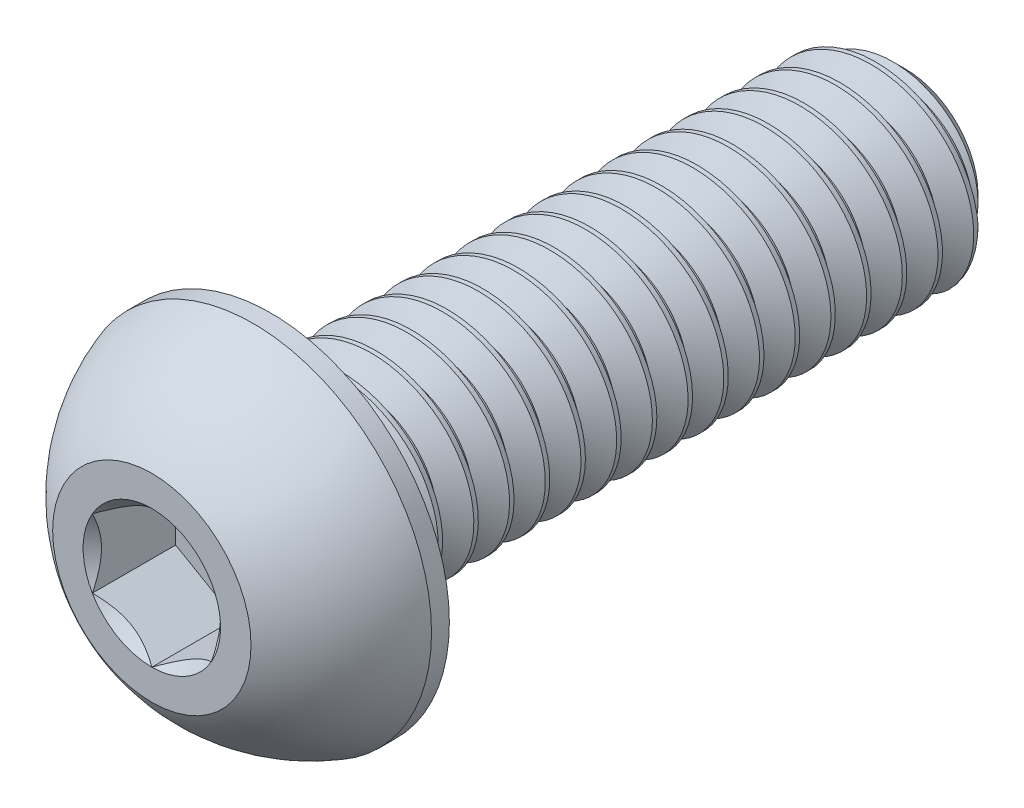
from build123d import *

# Parameters (mm, degrees)
CUT_EXTRUDE2_DEPTH = 1.05
CUT_SWEEP2_PITCH   = 0.45
CUT_SWEEP2_TO      = 8


with BuildPart() as part:
    # Sketch10 → Revolve3 (revolve)
    with BuildSketch(Plane(origin=(0, 0, 0), x_dir=(0, 0, -1), z_dir=(1, 0, 0)), mode=Mode.PRIVATE) as revolve3_sk:
        Polygon((9.1625, 1.25), (9.5, 0.9125), (9.5, 0), (1.5, 0), (1.5, 1.25), align=None)
    revolve(revolve3_sk.sketch.rotate(Axis((0, 0, 0), (0, 0, -1)), 90), axis=Axis((0, 0, 0), (0, 0, -1)))

    # Sketch7 → Revolve2 (revolve)
    with BuildSketch(Plane(origin=(0, 0, 0), x_dir=(0, 0, -1), z_dir=(1, 0, 0)), mode=Mode.PRIVATE) as revolve2_sk:
        with BuildLine():
            Line((1.275, 2.25), (1.5, 2.25))
            Line((1.5, 2.25), (1.5, 0))
            Line((1.5, 0), (0, 0))
            Line((0, 0), (0, 1.25))
            ThreePointArc((0, 1.25), (0.549264706, 1.8625), (1.275, 2.25))
        make_face()
    revolve(revolve2_sk.sketch.rotate(Axis((0, 0, 0), (0, 0, -1)), 180), axis=Axis((0, 0, 0), (0, 0, -1)))

    # Sketch5 → Cut-Extrude2 (cut)
    with BuildSketch(Plane.XY):
        Polygon((0.75, -0.433012702), (0.75, 0.433012702), (0, 0.866025404), (-0.75, 0.433012702), (-0.75, -0.433012702), (0, -0.866025404), align=None)
    extrude(amount=-CUT_EXTRUDE2_DEPTH, mode=Mode.SUBTRACT)

    # Cut-Extrude3 cone 1 section (through the dimple's axis) → Cut-Extrude3 (revolve, cut)
    with BuildSketch(Plane(origin=(0, 0, 0), x_dir=(0, -1, 0), z_dir=(1, 0, 0))):
        Polygon((0, 0), (0.866025404, 0), (0, 0.866025404), align=None)
    revolve(axis=Axis((0, 0, 0), (0, 0, -1)), mode=Mode.SUBTRACT)


with BuildPart() as body_2:
    # Split1: read off the stored shape, not the designer's step
    # Split1: the piece on the far side of the plane
    add(part.part)
    split(bisect_by=Plane.XY.offset(-1.5), keep=Keep.BOTTOM)

    # Cut-Sweep2: arcs per turn and ends read off the stored shape
    # Cut-Sweep2: the profile of Sketch12 screwed along a right-hand helix through 23 turns, 6 arcs to a turn; built about Z, then put on its axis
    cut_sweep2_z = Axis((0, 0, 0), (0, 0, 1))
    cut_sweep2_corners = [(0.957716426, 0, -0.16875), (0.957716426, 0, -0.225), (1.274356964, 0, -0.4078125), (1.274356964, 0, 0.0140625)]
    with BuildLine(mode=Mode.PRIVATE) as cut_sweep2_profile:
        Line(cut_sweep2_corners[0], cut_sweep2_corners[1])
        Line(cut_sweep2_corners[1], cut_sweep2_corners[2])
        Line(cut_sweep2_corners[2], cut_sweep2_corners[3])
        Line(cut_sweep2_corners[3], cut_sweep2_corners[0])
    cut_sweep2_cap = Face(cut_sweep2_profile.wire())
    cut_sweep2_turn_angles = [0, 30, 60, 90, 120, 150, 180, 210, 240, 270, 300, 330, 360]
    cut_sweep2_turn_weights = [1, 0.8660254037844387, 1, 0.8660254037844387, 1, 0.8660254037844387, 1, 0.8660254037844387, 1, 0.8660254037844387, 1, 0.8660254037844387, 1]
    cut_sweep2_turn_rails = [Edge.make_bspline([Vector(p[0], p[1], 0).rotate(cut_sweep2_z, cut_sweep2_turn_angles[k]) / cut_sweep2_turn_weights[k] + Vector(0, 0, p[2] + CUT_SWEEP2_PITCH * cut_sweep2_turn_angles[k] / 360) for k in range(13)], [0, 0, 0, 1, 1, 2, 2, 3, 3, 4, 4, 5, 5, 6, 6, 6], 2, cut_sweep2_turn_weights) for p in cut_sweep2_corners]
    cut_sweep2_turn_sides = [Face.make_surface_from_curves(cut_sweep2_turn_rails[p[0]], cut_sweep2_turn_rails[p[1]]) for p in [(0, 1), (1, 2), (2, 3), (3, 0)]]
    cut_sweep2 = Plane(origin=(0, 0, -9.5), x_dir=(0, 1, 0), z_dir=(0, 0, 1)) * split(Solid(Shell([*[p.moved(Location((0, 0, CUT_SWEEP2_PITCH * i))) for i in range(23) for p in cut_sweep2_turn_sides], cut_sweep2_cap, cut_sweep2_cap.rotate(cut_sweep2_z, 8280).moved(Location((0, 0, CUT_SWEEP2_PITCH * 8280 / 360)))])), bisect_by=Plane.XY.offset(CUT_SWEEP2_TO), keep=Keep.BOTTOM, mode=Mode.PRIVATE)
    add(cut_sweep2, mode=Mode.SUBTRACT)


with BuildPart() as part_1:
    add(part.part)

    # Split1
    split(bisect_by=Plane.XY.offset(-1.5), keep=Keep.TOP)

    add(body_2.part)  # Boss-Extrude1 merges body 2
    # Boss-Extrude1 cone 1 section (through the dimple's axis) → Boss-Extrude1 (revolve)
    with BuildSketch(Plane(origin=(0, 0, -1.5), x_dir=(0, -1, 0), z_dir=(1, 0, 0))):
        Polygon((0, 0), (1.25, 0), (0, 1.25), align=None)
    revolve(axis=Axis((0, 0, -1.5), (0, 0, -1)))


solid = part_1.part
